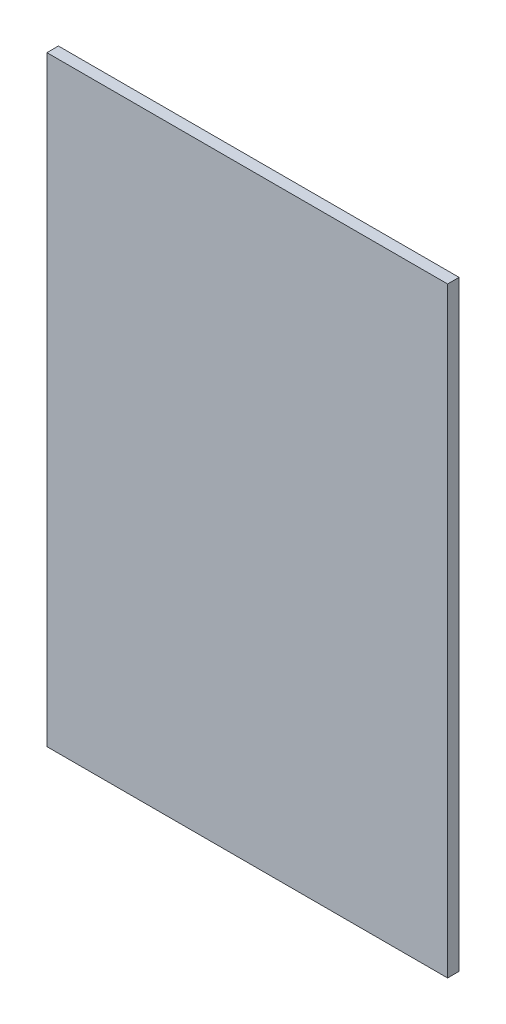
from build123d import *

# Parameters (mm, degrees)
SKETCH1_W           = 609.6
SKETCH1_H           = 914.4
BOSS_EXTRUDE1_DEPTH = 17.4752


with BuildPart() as part:
    # Sketch1 → Boss-Extrude1 (new body)
    with BuildSketch(Plane.XY):
        Rectangle(SKETCH1_W, SKETCH1_H)
    extrude(amount=BOSS_EXTRUDE1_DEPTH)


solid = part.part
